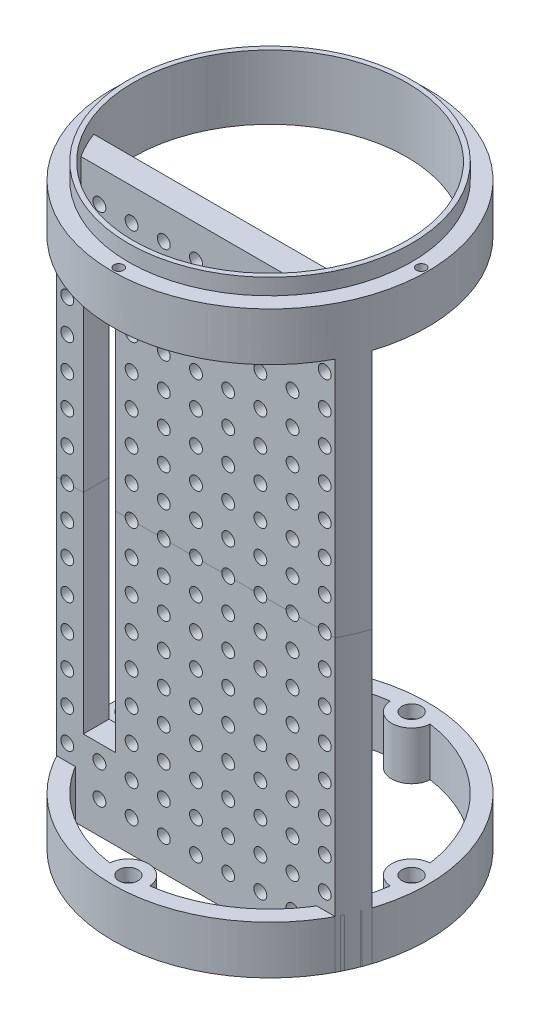
from build123d import *

# Parameters (mm, degrees)
SKETCH1_R                = 49
SKETCH1_R_2              = 44
BOSS_EXTRUDE1_DEPTH      = 15
BOSS_EXTRUDE2_DEPTH      = 75
BOSS_EXTRUDE2_DEPTH_BACK = 15
BOSS_EXTRUDE5_START      = -15
SKETCH3_R                = 44
SKETCH3_R_2              = 42.5
BOSS_EXTRUDE5_DEPTH      = 20
SKETCH4_R                = 1.5
CUT_EXTRUDE1_DEPTH       = 179.960889582
CIRPATTERN1_COUNT        = 4
BOSS_EXTRUDE6_DEPTH      = 15
CIRPATTERN2_COUNT        = 4
CUT_EXTRUDE2_START       = -15
SKETCH5_4_R              = 3
CUT_EXTRUDE2_DEPTH       = 4
CIRPATTERN3_COUNT        = 4
SKETCH6_R                = 1.55
CUT_EXTRUDE3_DEPTH       = 11
CIRPATTERN4_COUNT        = 4
SKETCH7_R                = 2
CUT_EXTRUDE5_DEPTH       = 8
FILL_START               = 15
FILL_PATTERN3_OUTLINE_R  = 2
FILL_PATTERN3_DEPTH      = 8
SKETCH11_W               = 10
SKETCH11_H               = 130
CUT_EXTRUDE6_DEPTH       = 10


# Read off the part's stored shape, not the designer's step: Fill Pattern3
with BuildPart() as part:
    # Sketch1 → Boss-Extrude1 (new body)
    with BuildSketch(Plane(origin=(0, 0, 0), x_dir=(1, 0, 0), z_dir=(0, 1, 0))):
        with Locations(Location((0, 0, 0), (0, 0, 270))):
            Circle(SKETCH1_R)
        with Locations(Location((0, 0, 0), (0, 0, 270))):
            Circle(SKETCH1_R_2, mode=Mode.SUBTRACT)
    extrude(amount=BOSS_EXTRUDE1_DEPTH)


with BuildPart() as body_2:
    # Sketch2 → Boss-Extrude2 (new, two sides: drawn at the far end of the back side and taken through both)
    with BuildSketch(Plane(origin=(0, 15, 0), x_dir=(1, 0, 0), z_dir=(0, 1, 0)).offset(-BOSS_EXTRUDE2_DEPTH_BACK)):
        with BuildLine():
            Line((-41.36423576, -15), (-46.647615159, -15))
            ThreePointArc((-46.647615159, -15), (-45.134711808, -19.07505675), (-43.266615306, -23))
            Line((-43.266615306, -23), (-37.509998667, -23))
            ThreePointArc((-37.509998667, -23), (-39.639452747, -19.09748114), (-41.36423576, -15))
        make_face()
        with BuildLine():
            Line((46.647615159, -15), (41.36423576, -15))
            ThreePointArc((41.36423576, -15), (39.639452747, -19.09748114), (37.509998667, -23))
            Line((37.509998667, -23), (43.266615306, -23))
            ThreePointArc((43.266615306, -23), (45.134711808, -19.07505675), (46.647615159, -15))
        make_face()
        with BuildLine():
            Line((41.36423576, -15), (-41.36423576, -15))
            ThreePointArc((-41.36423576, -15), (-39.639452747, -19.09748114), (-37.509998667, -23))
            Line((-37.509998667, -23), (37.509998667, -23))
            ThreePointArc((37.509998667, -23), (39.639452747, -19.09748114), (41.36423576, -15))
        make_face()
    extrude(amount=BOSS_EXTRUDE2_DEPTH + BOSS_EXTRUDE2_DEPTH_BACK)


with BuildPart() as body_3:
    # Mirror7: mirrored copy
    add(part.part.mirror(Plane(origin=(0, 90, 18.950111488), x_dir=(0, 0, 1), z_dir=(0, 1, 0))))



with BuildPart() as body_4:
    # Mirror7 2: mirrored copy
    add(body_2.part.mirror(Plane(origin=(0, 90, 18.950111488), x_dir=(0, 0, 1), z_dir=(0, 1, 0))))


with BuildPart() as body_3_1:
    add(body_3.part)

    add(body_4.part)  # Boss-Extrude5 merges body 4
    # Sketch3 → Boss-Extrude5 (add)
    with BuildSketch(Plane(origin=(0, 180, 0), x_dir=(1, 0, 0), z_dir=(0, 1, 0)).offset(BOSS_EXTRUDE5_START)):
        with Locations(Location((0, 0, 0), (0, 0, 270))):
            Circle(SKETCH3_R)
        with Locations(Location((0, 0, 0), (0, 0, 270))):
            Circle(SKETCH3_R_2, mode=Mode.SUBTRACT)
    extrude(amount=BOSS_EXTRUDE5_DEPTH)

    # Sketch4 → Cut-Extrude1 (cut, through all)
    with BuildSketch(Plane.XZ.offset(-165)):
        with Locations(Location((0, 46.99, 0), (0, 0, 270))):
            Circle(SKETCH4_R)
    cut_extrude1 = extrude(amount=-CUT_EXTRUDE1_DEPTH, mode=Mode.SUBTRACT)

    # CirPattern1: Cut-Extrude1 ×4 about axis
    cirpattern1_axis = Axis((0, 0, 0), (0, 1, 0))
    for i in range(1, CIRPATTERN1_COUNT):
        add(cut_extrude1.rotate(cirpattern1_axis, i * 360 / CIRPATTERN1_COUNT), mode=Mode.SUBTRACT)


with BuildPart() as part_1:
    add(part.part)

    # Sketch5 → Boss-Extrude6 (add)
    with BuildSketch(Plane.XZ):
        with BuildLine():
            ThreePointArc((6.196269707, -43.561522491), (0, -37.78823529), (-6.196269707, -43.561522491))
            ThreePointArc((-6.196269707, -43.561522491), (0, -44), (6.196269707, -43.561522491))
        make_face()
    boss_extrude6 = extrude(amount=-BOSS_EXTRUDE6_DEPTH)

    # CirPattern2: Boss-Extrude6 ×4 about axis
    cirpattern2_axis = Axis((0, 0, 0), (0, 1, 0))
    for i in range(1, CIRPATTERN2_COUNT):
        add(boss_extrude6.rotate(cirpattern2_axis, i * 360 / CIRPATTERN2_COUNT))

    # Sketch5<4> → Cut-Extrude2 (cut)
    with BuildSketch(Plane.XZ.offset(CUT_EXTRUDE2_START)):
        with Locations(Location((0, -44, 0), (0, 0, 90))):
            Circle(SKETCH5_4_R)
    cut_extrude2 = extrude(amount=CUT_EXTRUDE2_DEPTH, mode=Mode.SUBTRACT)

    # CirPattern3: Cut-Extrude2 ×4 about axis
    cirpattern3_axis = Axis((0, 0, 0), (0, 1, 0))
    for i in range(1, CIRPATTERN3_COUNT):
        add(cut_extrude2.rotate(cirpattern3_axis, i * 360 / CIRPATTERN3_COUNT), mode=Mode.SUBTRACT)

    # Sketch6 → Cut-Extrude3 (cut)
    with BuildSketch(Plane.XZ):
        with Locations(Location((0, -44, 0), (0, 0, 270))):
            Circle(SKETCH6_R)
    cut_extrude3 = extrude(amount=-CUT_EXTRUDE3_DEPTH, mode=Mode.SUBTRACT)

    # CirPattern4: Cut-Extrude3 ×4 about axis
    cirpattern4_axis = Axis((0, 0, 0), (0, 1, 0))
    for i in range(1, CIRPATTERN4_COUNT):
        add(cut_extrude3.rotate(cirpattern4_axis, i * 360 / CIRPATTERN4_COUNT), mode=Mode.SUBTRACT)


with BuildPart() as cut_extrude5_tool:
    # Sketch7 → Cut-Extrude5 (new body)
    with BuildSketch(Plane(origin=(0, 0, 15), x_dir=(-1, 0, 0), z_dir=(0, 0, -1))):
        with Locations((0, 90)):
            Circle(SKETCH7_R)
    extrude(amount=-CUT_EXTRUDE5_DEPTH)


with BuildPart() as body_2_1:
    add(body_2.part)

    # Cut-Extrude5: cut by cut_extrude5_tool
    add(cut_extrude5_tool.part, mode=Mode.SUBTRACT)


with BuildPart() as body_3_2:
    add(body_3_1.part)

    # Cut-Extrude5: cut by cut_extrude5_tool
    add(cut_extrude5_tool.part, mode=Mode.SUBTRACT)


with BuildPart() as fill_pattern3_tool:
    # Fill Pattern3 outline → Fill Pattern3 (new body)
    with BuildSketch(Plane.XY.offset(FILL_START)):
        with Locations((10, 100)):
            Circle(FILL_PATTERN3_OUTLINE_R)
        with Locations((0, 100)):
            Circle(FILL_PATTERN3_OUTLINE_R)
        with Locations((-10, 100)):
            Circle(FILL_PATTERN3_OUTLINE_R)
        with Locations((-10, 90)):
            Circle(FILL_PATTERN3_OUTLINE_R)
        with Locations((-40, 90)):
            Circle(FILL_PATTERN3_OUTLINE_R)
        with Locations((-30, 90)):
            Circle(FILL_PATTERN3_OUTLINE_R)
        with Locations((-20, 90)):
            Circle(FILL_PATTERN3_OUTLINE_R)
        with Locations((40, 90)):
            Circle(FILL_PATTERN3_OUTLINE_R)
        with Locations((30, 90)):
            Circle(FILL_PATTERN3_OUTLINE_R)
        with Locations((20, 90)):
            Circle(FILL_PATTERN3_OUTLINE_R)
        with Locations((10, 90)):
            Circle(FILL_PATTERN3_OUTLINE_R)
        with Locations((20, 110)):
            Circle(FILL_PATTERN3_OUTLINE_R)
        with Locations((10, 110)):
            Circle(FILL_PATTERN3_OUTLINE_R)
        with Locations((0, 110)):
            Circle(FILL_PATTERN3_OUTLINE_R)
        with Locations((-10, 110)):
            Circle(FILL_PATTERN3_OUTLINE_R)
        with Locations((-20, 110)):
            Circle(FILL_PATTERN3_OUTLINE_R)
        with Locations((-20, 100)):
            Circle(FILL_PATTERN3_OUTLINE_R)
        with Locations((20, 100)):
            Circle(FILL_PATTERN3_OUTLINE_R)
        with Locations((30, 120)):
            Circle(FILL_PATTERN3_OUTLINE_R)
        with Locations((20, 120)):
            Circle(FILL_PATTERN3_OUTLINE_R)
        with Locations((10, 120)):
            Circle(FILL_PATTERN3_OUTLINE_R)
        with Locations((0, 120)):
            Circle(FILL_PATTERN3_OUTLINE_R)
        with Locations((-10, 120)):
            Circle(FILL_PATTERN3_OUTLINE_R)
        with Locations((-20, 120)):
            Circle(FILL_PATTERN3_OUTLINE_R)
        with Locations((-30, 120)):
            Circle(FILL_PATTERN3_OUTLINE_R)
        with Locations((-30, 110)):
            Circle(FILL_PATTERN3_OUTLINE_R)
        with Locations((-30, 100)):
            Circle(FILL_PATTERN3_OUTLINE_R)
        with Locations((30, 100)):
            Circle(FILL_PATTERN3_OUTLINE_R)
        with Locations((30, 110)):
            Circle(FILL_PATTERN3_OUTLINE_R)
        with Locations((40, 130)):
            Circle(FILL_PATTERN3_OUTLINE_R)
        with Locations((30, 130)):
            Circle(FILL_PATTERN3_OUTLINE_R)
        with Locations((20, 130)):
            Circle(FILL_PATTERN3_OUTLINE_R)
        with Locations((10, 130)):
            Circle(FILL_PATTERN3_OUTLINE_R)
        with Locations((0, 130)):
            Circle(FILL_PATTERN3_OUTLINE_R)
        with Locations((-10, 130)):
            Circle(FILL_PATTERN3_OUTLINE_R)
        with Locations((-20, 130)):
            Circle(FILL_PATTERN3_OUTLINE_R)
        with Locations((-30, 130)):
            Circle(FILL_PATTERN3_OUTLINE_R)
        with Locations((-40, 130)):
            Circle(FILL_PATTERN3_OUTLINE_R)
        with Locations((-40, 120)):
            Circle(FILL_PATTERN3_OUTLINE_R)
        with Locations((-40, 110)):
            Circle(FILL_PATTERN3_OUTLINE_R)
        with Locations((-40, 100)):
            Circle(FILL_PATTERN3_OUTLINE_R)
        with Locations((40, 100)):
            Circle(FILL_PATTERN3_OUTLINE_R)
        with Locations((40, 110)):
            Circle(FILL_PATTERN3_OUTLINE_R)
        with Locations((40, 120)):
            Circle(FILL_PATTERN3_OUTLINE_R)
        with Locations((40, 140)):
            Circle(FILL_PATTERN3_OUTLINE_R)
        with Locations((30, 140)):
            Circle(FILL_PATTERN3_OUTLINE_R)
        with Locations((20, 140)):
            Circle(FILL_PATTERN3_OUTLINE_R)
        with Locations((10, 140)):
            Circle(FILL_PATTERN3_OUTLINE_R)
        with Locations((0, 140)):
            Circle(FILL_PATTERN3_OUTLINE_R)
        with Locations((-10, 140)):
            Circle(FILL_PATTERN3_OUTLINE_R)
        with Locations((-20, 140)):
            Circle(FILL_PATTERN3_OUTLINE_R)
        with Locations((-30, 140)):
            Circle(FILL_PATTERN3_OUTLINE_R)
        with Locations((-40, 140)):
            Circle(FILL_PATTERN3_OUTLINE_R)
        with Locations((40, 150)):
            Circle(FILL_PATTERN3_OUTLINE_R)
        with Locations((30, 150)):
            Circle(FILL_PATTERN3_OUTLINE_R)
        with Locations((20, 150)):
            Circle(FILL_PATTERN3_OUTLINE_R)
        with Locations((10, 150)):
            Circle(FILL_PATTERN3_OUTLINE_R)
        with Locations((0, 150)):
            Circle(FILL_PATTERN3_OUTLINE_R)
        with Locations((-10, 150)):
            Circle(FILL_PATTERN3_OUTLINE_R)
        with Locations((-20, 150)):
            Circle(FILL_PATTERN3_OUTLINE_R)
        with Locations((-30, 150)):
            Circle(FILL_PATTERN3_OUTLINE_R)
        with Locations((-40, 150)):
            Circle(FILL_PATTERN3_OUTLINE_R)
        with Locations((40, 160)):
            Circle(FILL_PATTERN3_OUTLINE_R)
        with Locations((30, 160)):
            Circle(FILL_PATTERN3_OUTLINE_R)
        with Locations((20, 160)):
            Circle(FILL_PATTERN3_OUTLINE_R)
        with Locations((10, 160)):
            Circle(FILL_PATTERN3_OUTLINE_R)
        with Locations((0, 160)):
            Circle(FILL_PATTERN3_OUTLINE_R)
        with Locations((-10, 160)):
            Circle(FILL_PATTERN3_OUTLINE_R)
        with Locations((-20, 160)):
            Circle(FILL_PATTERN3_OUTLINE_R)
        with Locations((-30, 160)):
            Circle(FILL_PATTERN3_OUTLINE_R)
        with Locations((-40, 160)):
            Circle(FILL_PATTERN3_OUTLINE_R)
        with Locations((30, 170)):
            Circle(FILL_PATTERN3_OUTLINE_R)
        with Locations((20, 170)):
            Circle(FILL_PATTERN3_OUTLINE_R)
        with Locations((10, 170)):
            Circle(FILL_PATTERN3_OUTLINE_R)
        with Locations((0, 170)):
            Circle(FILL_PATTERN3_OUTLINE_R)
        with Locations((-10, 170)):
            Circle(FILL_PATTERN3_OUTLINE_R)
        with Locations((-20, 170)):
            Circle(FILL_PATTERN3_OUTLINE_R)
        with Locations((-30, 170)):
            Circle(FILL_PATTERN3_OUTLINE_R)
        with Locations((-10, 80)):
            Circle(FILL_PATTERN3_OUTLINE_R)
        with Locations((0, 80)):
            Circle(FILL_PATTERN3_OUTLINE_R)
        with Locations((10, 80)):
            Circle(FILL_PATTERN3_OUTLINE_R)
        with Locations((-20, 80)):
            Circle(FILL_PATTERN3_OUTLINE_R)
        with Locations((-20, 70)):
            Circle(FILL_PATTERN3_OUTLINE_R)
        with Locations((-10, 70)):
            Circle(FILL_PATTERN3_OUTLINE_R)
        with Locations((0, 70)):
            Circle(FILL_PATTERN3_OUTLINE_R)
        with Locations((10, 70)):
            Circle(FILL_PATTERN3_OUTLINE_R)
        with Locations((20, 70)):
            Circle(FILL_PATTERN3_OUTLINE_R)
        with Locations((20, 80)):
            Circle(FILL_PATTERN3_OUTLINE_R)
        with Locations((-30, 80)):
            Circle(FILL_PATTERN3_OUTLINE_R)
        with Locations((-30, 70)):
            Circle(FILL_PATTERN3_OUTLINE_R)
        with Locations((-30, 60)):
            Circle(FILL_PATTERN3_OUTLINE_R)
        with Locations((-20, 60)):
            Circle(FILL_PATTERN3_OUTLINE_R)
        with Locations((-10, 60)):
            Circle(FILL_PATTERN3_OUTLINE_R)
        with Locations((0, 60)):
            Circle(FILL_PATTERN3_OUTLINE_R)
        with Locations((10, 60)):
            Circle(FILL_PATTERN3_OUTLINE_R)
        with Locations((20, 60)):
            Circle(FILL_PATTERN3_OUTLINE_R)
        with Locations((30, 60)):
            Circle(FILL_PATTERN3_OUTLINE_R)
        with Locations((30, 70)):
            Circle(FILL_PATTERN3_OUTLINE_R)
        with Locations((30, 80)):
            Circle(FILL_PATTERN3_OUTLINE_R)
        with Locations((-40, 80)):
            Circle(FILL_PATTERN3_OUTLINE_R)
        with Locations((-40, 70)):
            Circle(FILL_PATTERN3_OUTLINE_R)
        with Locations((-40, 60)):
            Circle(FILL_PATTERN3_OUTLINE_R)
        with Locations((-40, 50)):
            Circle(FILL_PATTERN3_OUTLINE_R)
        with Locations((-30, 50)):
            Circle(FILL_PATTERN3_OUTLINE_R)
        with Locations((-20, 50)):
            Circle(FILL_PATTERN3_OUTLINE_R)
        with Locations((-10, 50)):
            Circle(FILL_PATTERN3_OUTLINE_R)
        with Locations((0, 50)):
            Circle(FILL_PATTERN3_OUTLINE_R)
        with Locations((10, 50)):
            Circle(FILL_PATTERN3_OUTLINE_R)
        with Locations((20, 50)):
            Circle(FILL_PATTERN3_OUTLINE_R)
        with Locations((30, 50)):
            Circle(FILL_PATTERN3_OUTLINE_R)
        with Locations((40, 50)):
            Circle(FILL_PATTERN3_OUTLINE_R)
        with Locations((40, 60)):
            Circle(FILL_PATTERN3_OUTLINE_R)
        with Locations((40, 70)):
            Circle(FILL_PATTERN3_OUTLINE_R)
        with Locations((40, 80)):
            Circle(FILL_PATTERN3_OUTLINE_R)
        with Locations((-40, 40)):
            Circle(FILL_PATTERN3_OUTLINE_R)
        with Locations((-30, 40)):
            Circle(FILL_PATTERN3_OUTLINE_R)
        with Locations((-20, 40)):
            Circle(FILL_PATTERN3_OUTLINE_R)
        with Locations((-10, 40)):
            Circle(FILL_PATTERN3_OUTLINE_R)
        with Locations((0, 40)):
            Circle(FILL_PATTERN3_OUTLINE_R)
        with Locations((10, 40)):
            Circle(FILL_PATTERN3_OUTLINE_R)
        with Locations((20, 40)):
            Circle(FILL_PATTERN3_OUTLINE_R)
        with Locations((30, 40)):
            Circle(FILL_PATTERN3_OUTLINE_R)
        with Locations((40, 40)):
            Circle(FILL_PATTERN3_OUTLINE_R)
        with Locations((-40, 30)):
            Circle(FILL_PATTERN3_OUTLINE_R)
        with Locations((-30, 30)):
            Circle(FILL_PATTERN3_OUTLINE_R)
        with Locations((-20, 30)):
            Circle(FILL_PATTERN3_OUTLINE_R)
        with Locations((-10, 30)):
            Circle(FILL_PATTERN3_OUTLINE_R)
        with Locations((0, 30)):
            Circle(FILL_PATTERN3_OUTLINE_R)
        with Locations((10, 30)):
            Circle(FILL_PATTERN3_OUTLINE_R)
        with Locations((20, 30)):
            Circle(FILL_PATTERN3_OUTLINE_R)
        with Locations((30, 30)):
            Circle(FILL_PATTERN3_OUTLINE_R)
        with Locations((40, 30)):
            Circle(FILL_PATTERN3_OUTLINE_R)
        with Locations((-40, 20)):
            Circle(FILL_PATTERN3_OUTLINE_R)
        with Locations((-30, 20)):
            Circle(FILL_PATTERN3_OUTLINE_R)
        with Locations((-20, 20)):
            Circle(FILL_PATTERN3_OUTLINE_R)
        with Locations((-10, 20)):
            Circle(FILL_PATTERN3_OUTLINE_R)
        with Locations((0, 20)):
            Circle(FILL_PATTERN3_OUTLINE_R)
        with Locations((10, 20)):
            Circle(FILL_PATTERN3_OUTLINE_R)
        with Locations((20, 20)):
            Circle(FILL_PATTERN3_OUTLINE_R)
        with Locations((30, 20)):
            Circle(FILL_PATTERN3_OUTLINE_R)
        with Locations((40, 20)):
            Circle(FILL_PATTERN3_OUTLINE_R)
        with Locations((-30, 10)):
            Circle(FILL_PATTERN3_OUTLINE_R)
        with Locations((-20, 10)):
            Circle(FILL_PATTERN3_OUTLINE_R)
        with Locations((-10, 10)):
            Circle(FILL_PATTERN3_OUTLINE_R)
        with Locations((0, 10)):
            Circle(FILL_PATTERN3_OUTLINE_R)
        with Locations((10, 10)):
            Circle(FILL_PATTERN3_OUTLINE_R)
        with Locations((20, 10)):
            Circle(FILL_PATTERN3_OUTLINE_R)
        with Locations((30, 10)):
            Circle(FILL_PATTERN3_OUTLINE_R)
    extrude(amount=FILL_PATTERN3_DEPTH)


with BuildPart() as body_2_2:
    add(body_2_1.part)

    # Fill Pattern3: cut by fill_pattern3_tool
    add(fill_pattern3_tool.part, mode=Mode.SUBTRACT)


with BuildPart() as body_3_3:
    add(body_3_2.part)

    # Fill Pattern3: cut by fill_pattern3_tool
    add(fill_pattern3_tool.part, mode=Mode.SUBTRACT)


with BuildPart() as cut_extrude6_tool:
    # Sketch11 → Cut-Extrude6 (new body)
    with BuildSketch(Plane(origin=(0, 0, 15), x_dir=(-1, 0, 0), z_dir=(0, 0, -1))):
        with Locations((30, 90)):
            Rectangle(SKETCH11_W, SKETCH11_H)
    extrude(amount=-CUT_EXTRUDE6_DEPTH)


with BuildPart() as body_2_3:
    add(body_2_2.part)

    # Cut-Extrude6: cut by cut_extrude6_tool
    add(cut_extrude6_tool.part, mode=Mode.SUBTRACT)


with BuildPart() as body_3_4:
    add(body_3_3.part)

    # Cut-Extrude6: cut by cut_extrude6_tool
    add(cut_extrude6_tool.part, mode=Mode.SUBTRACT)


solid = Compound([part_1.part, body_2_3.part, body_3_4.part])
